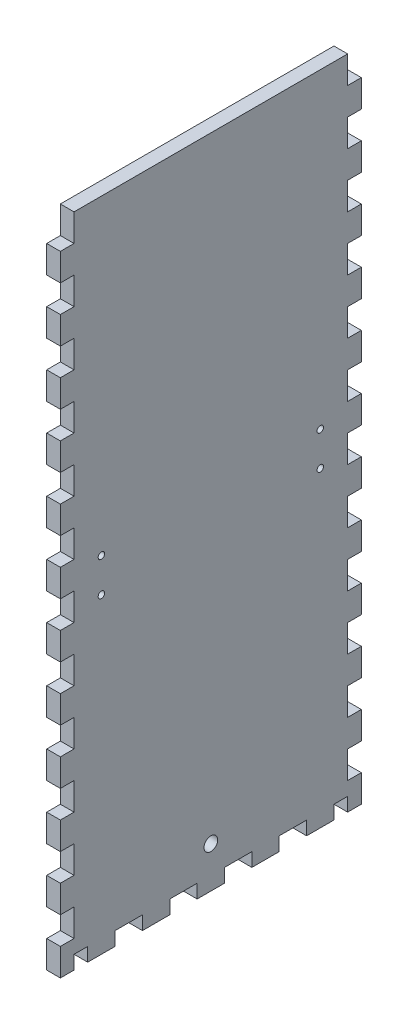
from build123d import *

# Parameters (mm, degrees)
SKETCH1_W              = 273.05
SKETCH1_H              = 139.7
BOSS_EXTRUDE1_DEPTH    = 6.35
SKETCH2_W              = 273.05
SKETCH2_H              = 139.7
SKETCH2_W_2            = 260.35
SKETCH2_H_2            = 127
BOSS_EXTRUDE2_DEPTH    = 298.45
SKETCH3_W              = 6.35
SKETCH3_H              = 16.933333333
SKETCH3_H_2            = 16.933333334
DOOR_SLOT_DEPTH        = 12.7
DOOR_GUIDE_HOLES_REACH = 361.617
SKETCH4_W              = 6.35
SKETCH4_H              = 15.875
LEVER_HOLES_W          = 9.652
LEVER_HOLES_H          = 6.35
LEVER_HOLES_W_2        = 6.35
CUT_EXTRUDE1_DEPTH     = 363.019620497
CUT_EXTRUDE2_REACH     = 417.137
SKETCH7_R              = 3.175
SKETCH7_R_2            = 26.9875
CUT_EXTRUDE3_REACH     = 417.137
SKETCH8_R              = 3.175
SKETCH8_R_2            = 1.5
SKETCH16_W             = 336.131526087
SKETCH16_H             = 315.233565403
CUT_EXTRUDE10_DEPTH    = 363.019620497
LEFT_RIGHT_W           = 6.35
LEFT_RIGHT_H           = 6.35
LEFT_RIGHT_W_2         = 12.7
LEFT_RIGHT_H_2         = 12.7
CUT_EXTRUDE11_DEPTH    = 313.765703043


with BuildPart() as part:
    # Sketch1 → Boss-Extrude1 (new body)
    with BuildSketch(Plane(origin=(0, 0, 0), x_dir=(1, 0, 0), z_dir=(0, 1, 0))):
        Rectangle(SKETCH1_W, SKETCH1_H)
    extrude(amount=BOSS_EXTRUDE1_DEPTH)

    # Sketch2 → Boss-Extrude2 (add)
    with BuildSketch(Plane(origin=(0, 6.35, 0), x_dir=(1, 0, 0), z_dir=(0, 1, 0))):
        Rectangle(SKETCH2_W, SKETCH2_H)
        Rectangle(SKETCH2_W_2, SKETCH2_H_2, mode=Mode.SUBTRACT)
    extrude(amount=BOSS_EXTRUDE2_DEPTH)

    # Sketch3 → Door Slot (cut)
    with BuildSketch(Plane.XY.offset(69.85)):
        with BuildLine():
            Line((-28.575, 283.21), (-28.575, 6.35))
            Line((-28.575, 6.35), (-21.971, 6.35))
            Line((-21.971, 6.35), (-21.971, 292.354))
            Line((-21.971, 292.354), (-41.529, 292.354))
            Line((-41.529, 292.354), (-41.529, 285.75))
            Line((-41.529, 285.75), (-31.115, 285.75))
            ThreePointArc((-31.115, 285.75), (-29.318948776, 285.006051224), (-28.575, 283.21))
        make_face()
        with Locations((-12.446, 80.433333334)):
            Rectangle(SKETCH3_W, SKETCH3_H)
        with Locations((-12.446, 50.8)):
            Rectangle(SKETCH3_W, SKETCH3_H_2)
        with Locations((-12.446, 21.166666667)):
            Rectangle(SKETCH3_W, SKETCH3_H)
    extrude(amount=-DOOR_SLOT_DEPTH, mode=Mode.SUBTRACT)

    # Sketch4 → Door Guide Holes (cut, up to next)
    with BuildSketch(Plane.XY.offset(-63.5), mode=Mode.PRIVATE) as door_guide_holes_sk1:
        with Locations((-44.704, 284.1625)):
            Rectangle(SKETCH4_W, SKETCH4_H)
    door_guide_holes_tool1 = extrude(door_guide_holes_sk1.sketch, amount=-DOOR_GUIDE_HOLES_REACH, mode=Mode.PRIVATE) & part.part
    # Sketch4 → Door Guide Holes (cut, up to next)
    with BuildSketch(Plane.XY.offset(-63.5), mode=Mode.PRIVATE) as door_guide_holes_sk2:
        with Locations((-44.704, 255.5875)):
            Rectangle(SKETCH4_W, SKETCH4_H)
    door_guide_holes_tool2 = extrude(door_guide_holes_sk2.sketch, amount=-DOOR_GUIDE_HOLES_REACH, mode=Mode.PRIVATE) & part.part
    # Sketch4 → Door Guide Holes (cut, up to next)
    with BuildSketch(Plane.XY.offset(-63.5), mode=Mode.PRIVATE) as door_guide_holes_sk3:
        with Locations((-44.704, 227.0125)):
            Rectangle(SKETCH4_W, SKETCH4_H)
    door_guide_holes_tool3 = extrude(door_guide_holes_sk3.sketch, amount=-DOOR_GUIDE_HOLES_REACH, mode=Mode.PRIVATE) & part.part
    # Sketch4 → Door Guide Holes (cut, up to next)
    with BuildSketch(Plane.XY.offset(-63.5), mode=Mode.PRIVATE) as door_guide_holes_sk4:
        with Locations((-44.704, 198.4375)):
            Rectangle(SKETCH4_W, SKETCH4_H)
    door_guide_holes_tool4 = extrude(door_guide_holes_sk4.sketch, amount=-DOOR_GUIDE_HOLES_REACH, mode=Mode.PRIVATE) & part.part
    # Sketch4 → Door Guide Holes (cut, up to next)
    with BuildSketch(Plane.XY.offset(-63.5), mode=Mode.PRIVATE) as door_guide_holes_sk5:
        with Locations((-44.704, 169.8625)):
            Rectangle(SKETCH4_W, SKETCH4_H)
    door_guide_holes_tool5 = extrude(door_guide_holes_sk5.sketch, amount=-DOOR_GUIDE_HOLES_REACH, mode=Mode.PRIVATE) & part.part
    # Sketch4 → Door Guide Holes (cut, up to next)
    with BuildSketch(Plane.XY.offset(-63.5), mode=Mode.PRIVATE) as door_guide_holes_sk6:
        with Locations((-44.704, 141.2875)):
            Rectangle(SKETCH4_W, SKETCH4_H)
    door_guide_holes_tool6 = extrude(door_guide_holes_sk6.sketch, amount=-DOOR_GUIDE_HOLES_REACH, mode=Mode.PRIVATE) & part.part
    # Sketch4 → Door Guide Holes (cut, up to next)
    with BuildSketch(Plane.XY.offset(-63.5), mode=Mode.PRIVATE) as door_guide_holes_sk7:
        with Locations((-44.704, 112.7125)):
            Rectangle(SKETCH4_W, SKETCH4_H)
    door_guide_holes_tool7 = extrude(door_guide_holes_sk7.sketch, amount=-DOOR_GUIDE_HOLES_REACH, mode=Mode.PRIVATE) & part.part
    # Sketch4 → Door Guide Holes (cut, up to next)
    with BuildSketch(Plane.XY.offset(-63.5), mode=Mode.PRIVATE) as door_guide_holes_sk8:
        with Locations((-44.704, 84.1375)):
            Rectangle(SKETCH4_W, SKETCH4_H)
    door_guide_holes_tool8 = extrude(door_guide_holes_sk8.sketch, amount=-DOOR_GUIDE_HOLES_REACH, mode=Mode.PRIVATE) & part.part
    # Sketch4 → Door Guide Holes (cut, up to next)
    with BuildSketch(Plane.XY.offset(-63.5), mode=Mode.PRIVATE) as door_guide_holes_sk9:
        with Locations((-44.704, 55.5625)):
            Rectangle(SKETCH4_W, SKETCH4_H)
    door_guide_holes_tool9 = extrude(door_guide_holes_sk9.sketch, amount=-DOOR_GUIDE_HOLES_REACH, mode=Mode.PRIVATE) & part.part
    # Sketch4 → Door Guide Holes (cut, up to next)
    with BuildSketch(Plane.XY.offset(-63.5), mode=Mode.PRIVATE) as door_guide_holes_sk10:
        with Locations((-44.704, 26.9875)):
            Rectangle(SKETCH4_W, SKETCH4_H)
    door_guide_holes_tool10 = extrude(door_guide_holes_sk10.sketch, amount=-DOOR_GUIDE_HOLES_REACH, mode=Mode.PRIVATE) & part.part
    door_guide_holes_1 = door_guide_holes_tool1.solids().sort_by_distance((-44.704, 284.1625, -63.5))[0]
    add(door_guide_holes_1, mode=Mode.SUBTRACT)
    door_guide_holes_2 = door_guide_holes_tool2.solids().sort_by_distance((-44.704, 255.5875, -63.5))[0]
    add(door_guide_holes_2, mode=Mode.SUBTRACT)
    door_guide_holes_3 = door_guide_holes_tool3.solids().sort_by_distance((-44.704, 227.0125, -63.5))[0]
    add(door_guide_holes_3, mode=Mode.SUBTRACT)
    door_guide_holes_4 = door_guide_holes_tool4.solids().sort_by_distance((-44.704, 198.4375, -63.5))[0]
    add(door_guide_holes_4, mode=Mode.SUBTRACT)
    door_guide_holes_5 = door_guide_holes_tool5.solids().sort_by_distance((-44.704, 169.8625, -63.5))[0]
    add(door_guide_holes_5, mode=Mode.SUBTRACT)
    door_guide_holes_6 = door_guide_holes_tool6.solids().sort_by_distance((-44.704, 141.2875, -63.5))[0]
    add(door_guide_holes_6, mode=Mode.SUBTRACT)
    door_guide_holes_7 = door_guide_holes_tool7.solids().sort_by_distance((-44.704, 112.7125, -63.5))[0]
    add(door_guide_holes_7, mode=Mode.SUBTRACT)
    door_guide_holes_8 = door_guide_holes_tool8.solids().sort_by_distance((-44.704, 84.1375, -63.5))[0]
    add(door_guide_holes_8, mode=Mode.SUBTRACT)
    door_guide_holes_9 = door_guide_holes_tool9.solids().sort_by_distance((-44.704, 55.5625, -63.5))[0]
    add(door_guide_holes_9, mode=Mode.SUBTRACT)
    door_guide_holes_10 = door_guide_holes_tool10.solids().sort_by_distance((-44.704, 26.9875, -63.5))[0]
    add(door_guide_holes_10, mode=Mode.SUBTRACT)
    door_guide_holes = door_guide_holes_1 + door_guide_holes_2 + door_guide_holes_3 + door_guide_holes_4 + door_guide_holes_5 + door_guide_holes_6 + door_guide_holes_7 + door_guide_holes_8 + door_guide_holes_9 + door_guide_holes_10  # Door Guide Holes as one shape, for the pattern or mirror that repeats it

    # Mirror1: Door Guide Holes across plane
    add(door_guide_holes.mirror(Plane.ZY.offset(31.75)), mode=Mode.SUBTRACT)

    # Lever Holes → Cut-Extrude1 (cut, through all)
    with BuildSketch(Plane.XY.offset(69.85)):
        with Locations((54.102, 28.575)):
            Rectangle(LEVER_HOLES_W, LEVER_HOLES_H)
        with Locations((39.3065, 15.875)):
            Rectangle(LEVER_HOLES_W_2, LEVER_HOLES_H)
        with Locations((68.8975, 15.875)):
            Rectangle(LEVER_HOLES_W_2, LEVER_HOLES_H)
    extrude(amount=-CUT_EXTRUDE1_DEPTH, mode=Mode.SUBTRACT)

    # Sketch7 → Cut-Extrude2 (cut, up to next)
    with BuildSketch(Plane(origin=(136.525, 0, 0), x_dir=(0, 0, -1), z_dir=(1, 0, 0)), mode=Mode.PRIVATE) as cut_extrude2_sk1:
        with Locations((-37.211, 92.583)):
            Circle(SKETCH7_R)
    cut_extrude2_tool1 = extrude(cut_extrude2_sk1.sketch, amount=-CUT_EXTRUDE2_REACH, mode=Mode.PRIVATE) & part.part
    # Sketch7 → Cut-Extrude2 (cut, up to next)
    with BuildSketch(Plane(origin=(136.525, 0, 0), x_dir=(0, 0, -1), z_dir=(1, 0, 0)), mode=Mode.PRIVATE) as cut_extrude2_sk2:
        with Locations((37.211, 92.583)):
            Circle(SKETCH7_R)
    cut_extrude2_tool2 = extrude(cut_extrude2_sk2.sketch, amount=-CUT_EXTRUDE2_REACH, mode=Mode.PRIVATE) & part.part
    # Sketch7 → Cut-Extrude2 (cut, up to next)
    with BuildSketch(Plane(origin=(136.525, 0, 0), x_dir=(0, 0, -1), z_dir=(1, 0, 0)), mode=Mode.PRIVATE) as cut_extrude2_sk3:
        with Locations((-37.211, 18.161)):
            Circle(SKETCH7_R)
    cut_extrude2_tool3 = extrude(cut_extrude2_sk3.sketch, amount=-CUT_EXTRUDE2_REACH, mode=Mode.PRIVATE) & part.part
    # Sketch7 → Cut-Extrude2 (cut, up to next)
    with BuildSketch(Plane(origin=(136.525, 0, 0), x_dir=(0, 0, -1), z_dir=(1, 0, 0)), mode=Mode.PRIVATE) as cut_extrude2_sk4:
        with Locations((37.211, 18.161)):
            Circle(SKETCH7_R)
    cut_extrude2_tool4 = extrude(cut_extrude2_sk4.sketch, amount=-CUT_EXTRUDE2_REACH, mode=Mode.PRIVATE) & part.part
    # Sketch7 → Cut-Extrude2 (cut, up to next)
    with BuildSketch(Plane(origin=(136.525, 0, 0), x_dir=(0, 0, -1), z_dir=(1, 0, 0)), mode=Mode.PRIVATE) as cut_extrude2_sk5:
        with Locations((0, 55.372)):
            Circle(SKETCH7_R_2)
    cut_extrude2_tool5 = extrude(cut_extrude2_sk5.sketch, amount=-CUT_EXTRUDE2_REACH, mode=Mode.PRIVATE) & part.part
    add(cut_extrude2_tool1.solids().sort_by_distance((136.525, 92.583, 37.211))[0], mode=Mode.SUBTRACT)
    add(cut_extrude2_tool2.solids().sort_by_distance((136.525, 92.583, -37.211))[0], mode=Mode.SUBTRACT)
    add(cut_extrude2_tool3.solids().sort_by_distance((136.525, 18.161, 37.211))[0], mode=Mode.SUBTRACT)
    add(cut_extrude2_tool4.solids().sort_by_distance((136.525, 18.161, -37.211))[0], mode=Mode.SUBTRACT)
    add(cut_extrude2_tool5.solids().sort_by_distance((136.525, 55.372, 0))[0], mode=Mode.SUBTRACT)

    # Sketch8 → Cut-Extrude3 (cut, up to next)
    with BuildSketch(Plane.ZY.offset(136.525), mode=Mode.PRIVATE) as cut_extrude3_sk1:
        with Locations((0, 19.05)):
            Circle(SKETCH8_R)
    cut_extrude3_tool1 = extrude(cut_extrude3_sk1.sketch, amount=-CUT_EXTRUDE3_REACH, mode=Mode.PRIVATE) & part.part
    # Sketch8 → Cut-Extrude3 (cut, up to next)
    with BuildSketch(Plane.ZY.offset(136.525), mode=Mode.PRIVATE) as cut_extrude3_sk2:
        with Locations((-50.8, 160.275)):
            Circle(SKETCH8_R_2)
    cut_extrude3_tool2 = extrude(cut_extrude3_sk2.sketch, amount=-CUT_EXTRUDE3_REACH, mode=Mode.PRIVATE) & part.part
    # Sketch8 → Cut-Extrude3 (cut, up to next)
    with BuildSketch(Plane.ZY.offset(136.525), mode=Mode.PRIVATE) as cut_extrude3_sk3:
        with Locations((-50.8, 144.525)):
            Circle(SKETCH8_R_2)
    cut_extrude3_tool3 = extrude(cut_extrude3_sk3.sketch, amount=-CUT_EXTRUDE3_REACH, mode=Mode.PRIVATE) & part.part
    # Sketch8 → Cut-Extrude3 (cut, up to next)
    with BuildSketch(Plane.ZY.offset(136.525), mode=Mode.PRIVATE) as cut_extrude3_sk4:
        with Locations((50.8, 144.525)):
            Circle(SKETCH8_R_2)
    cut_extrude3_tool4 = extrude(cut_extrude3_sk4.sketch, amount=-CUT_EXTRUDE3_REACH, mode=Mode.PRIVATE) & part.part
    # Sketch8 → Cut-Extrude3 (cut, up to next)
    with BuildSketch(Plane.ZY.offset(136.525), mode=Mode.PRIVATE) as cut_extrude3_sk5:
        with Locations((50.8, 160.275)):
            Circle(SKETCH8_R_2)
    cut_extrude3_tool5 = extrude(cut_extrude3_sk5.sketch, amount=-CUT_EXTRUDE3_REACH, mode=Mode.PRIVATE) & part.part
    add(cut_extrude3_tool1.solids().sort_by_distance((-136.525, 19.05, 0))[0], mode=Mode.SUBTRACT)
    add(cut_extrude3_tool2.solids().sort_by_distance((-136.525, 160.275, -50.8))[0], mode=Mode.SUBTRACT)
    add(cut_extrude3_tool3.solids().sort_by_distance((-136.525, 144.525, -50.8))[0], mode=Mode.SUBTRACT)
    add(cut_extrude3_tool4.solids().sort_by_distance((-136.525, 144.525, 50.8))[0], mode=Mode.SUBTRACT)
    add(cut_extrude3_tool5.solids().sort_by_distance((-136.525, 160.275, 50.8))[0], mode=Mode.SUBTRACT)

    # Sketch16 → Cut-Extrude10 (cut, through all)
    with BuildSketch(Plane.XY.offset(69.85)):
        with Locations((37.890763044, 147.183217299)):
            Rectangle(SKETCH16_W, SKETCH16_H)
    extrude(amount=-CUT_EXTRUDE10_DEPTH, mode=Mode.SUBTRACT)

    # Left/Right → Cut-Extrude11 (cut, through all)
    with BuildSketch(Plane.ZY.offset(136.525)):
        with Locations((60.325, 3.175)):
            Rectangle(LEFT_RIGHT_W, LEFT_RIGHT_H)
        with Locations((38.1, 3.175)):
            Rectangle(LEFT_RIGHT_W_2, LEFT_RIGHT_H)
        with Locations((66.675, 19.05)):
            Rectangle(LEFT_RIGHT_W, LEFT_RIGHT_H_2)
        with Locations((12.7, 3.175)):
            Rectangle(LEFT_RIGHT_W_2, LEFT_RIGHT_H)
        with Locations((66.675, 44.45)):
            Rectangle(LEFT_RIGHT_W, LEFT_RIGHT_H_2)
        with Locations((-12.7, 3.175)):
            Rectangle(LEFT_RIGHT_W_2, LEFT_RIGHT_H)
        with Locations((66.675, 69.85)):
            Rectangle(LEFT_RIGHT_W, LEFT_RIGHT_H_2)
        with Locations((-38.1, 3.175)):
            Rectangle(LEFT_RIGHT_W_2, LEFT_RIGHT_H)
        with Locations((66.675, 95.25)):
            Rectangle(LEFT_RIGHT_W, LEFT_RIGHT_H_2)
        with Locations((-60.325, 3.175)):
            Rectangle(LEFT_RIGHT_W, LEFT_RIGHT_H)
        with Locations((66.675, 120.65)):
            Rectangle(LEFT_RIGHT_W, LEFT_RIGHT_H_2)
        with Locations((-66.675, 19.05)):
            Rectangle(LEFT_RIGHT_W, LEFT_RIGHT_H_2)
        with Locations((66.675, 146.05)):
            Rectangle(LEFT_RIGHT_W, LEFT_RIGHT_H_2)
        with Locations((-66.675, 44.45)):
            Rectangle(LEFT_RIGHT_W, LEFT_RIGHT_H_2)
        with Locations((66.675, 171.45)):
            Rectangle(LEFT_RIGHT_W, LEFT_RIGHT_H_2)
        with Locations((-66.675, 69.85)):
            Rectangle(LEFT_RIGHT_W, LEFT_RIGHT_H_2)
        with Locations((66.675, 196.85)):
            Rectangle(LEFT_RIGHT_W, LEFT_RIGHT_H_2)
        with Locations((-66.675, 95.25)):
            Rectangle(LEFT_RIGHT_W, LEFT_RIGHT_H_2)
        with Locations((66.675, 222.25)):
            Rectangle(LEFT_RIGHT_W, LEFT_RIGHT_H_2)
        with Locations((-66.675, 120.65)):
            Rectangle(LEFT_RIGHT_W, LEFT_RIGHT_H_2)
        with Locations((66.675, 247.65)):
            Rectangle(LEFT_RIGHT_W, LEFT_RIGHT_H_2)
        with Locations((-66.675, 146.05)):
            Rectangle(LEFT_RIGHT_W, LEFT_RIGHT_H_2)
        with Locations((66.675, 273.05)):
            Rectangle(LEFT_RIGHT_W, LEFT_RIGHT_H_2)
        with Locations((-66.675, 171.45)):
            Rectangle(LEFT_RIGHT_W, LEFT_RIGHT_H_2)
        with Locations((66.675, 298.45)):
            Rectangle(LEFT_RIGHT_W, LEFT_RIGHT_H_2)
        with Locations((-66.675, 196.85)):
            Rectangle(LEFT_RIGHT_W, LEFT_RIGHT_H_2)
        with Locations((-66.675, 298.45)):
            Rectangle(LEFT_RIGHT_W, LEFT_RIGHT_H_2)
        with Locations((-66.675, 222.25)):
            Rectangle(LEFT_RIGHT_W, LEFT_RIGHT_H_2)
        with Locations((-66.675, 273.05)):
            Rectangle(LEFT_RIGHT_W, LEFT_RIGHT_H_2)
        with Locations((-66.675, 247.65)):
            Rectangle(LEFT_RIGHT_W, LEFT_RIGHT_H_2)
    extrude(amount=-CUT_EXTRUDE11_DEPTH, mode=Mode.SUBTRACT)


solid = part.part
